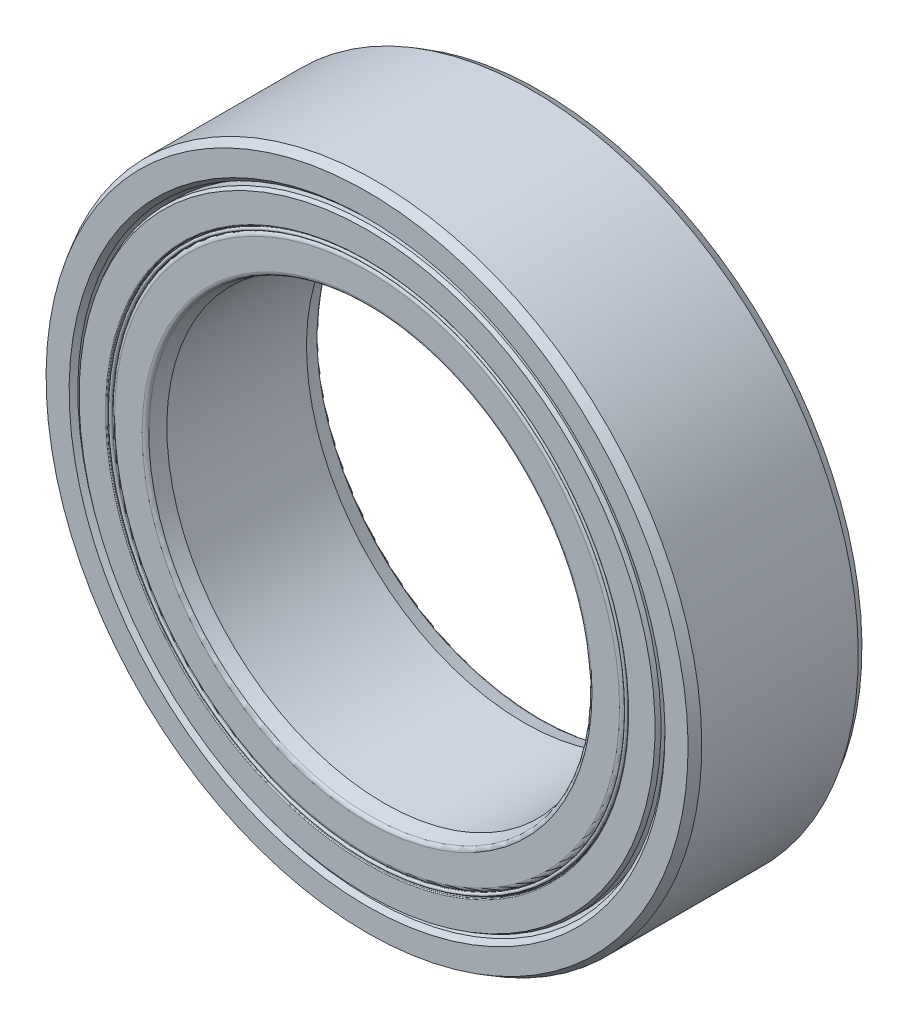
from build123d import *

# Parameters (mm, degrees)
CIRPATTERN1_COUNT = 14


with BuildPart() as part:
    # Sketch3 → Revolve1 (revolve)
    with BuildSketch(Plane(origin=(0, 0, 0), x_dir=(0, 0, -1), z_dir=(1, 0, 0))):
        with BuildLine():
            Line((-1.682987285, 6.675), (-1.9, 6.753986169))
            Line((-1.9, 6.753986169), (-2, 6.853986169))
            Line((-2, 6.853986169), (-2, 7.384529946))
            Line((-2, 7.384529946), (-1.8, 7.5))
            Line((-1.8, 7.5), (1.8, 7.5))
            Line((1.8, 7.5), (2, 7.384529946))
            Line((2, 7.384529946), (2, 6.853986169))
            Line((2, 6.853986169), (1.9, 6.753986169))
            Line((1.9, 6.753986169), (1.682987285, 6.675))
            Line((1.682987285, 6.675), (0.853668554, 6.675))
            ThreePointArc((0.853668554, 6.675), (0, 7.225), (-0.853668554, 6.675))
            Line((-0.853668554, 6.675), (-1.682987285, 6.675))
        make_face()
    revolve(axis=Axis((0, 0, 2), (0, 0, -1)))


with BuildPart() as body_2:
    # Sketch4 → Revolve2 (revolve)
    with BuildSketch(Plane(origin=(0, 0, 0), x_dir=(0, 0, -1), z_dir=(1, 0, 0))):
        with BuildLine():
            Line((-1.606304443, 5), (-1.932858889, 5.0875))
            ThreePointArc((-1.932858889, 5.0875), (-1.981280568, 5.119854332), (-2, 5.175))
            Line((-2, 5.175), (-2, 5.809413334))
            ThreePointArc((-2, 5.809413334), (-1.97346778, 5.87346778), (-1.909413334, 5.9))
            Line((-1.909413334, 5.9), (-0.853668554, 5.9))
            ThreePointArc((-0.853668554, 5.9), (0, 5.35), (0.853668554, 5.9))
            Line((0.853668554, 5.9), (1.909413334, 5.9))
            ThreePointArc((1.909413334, 5.9), (1.97346778, 5.87346778), (2, 5.809413334))
            Line((2, 5.809413334), (2, 5.175))
            ThreePointArc((2, 5.175), (1.981280568, 5.119854332), (1.932858889, 5.0875))
            Line((1.932858889, 5.0875), (1.606304443, 5))
            Line((1.606304443, 5), (-1.606304443, 5))
        make_face()
    revolve(axis=Axis((0, 0, 2), (0, 0, -1)))


with BuildPart() as body_3:
    # Sketch5 → Revolve3 (revolve)
    with BuildSketch(Plane(origin=(0, 0, 0), x_dir=(0, 0, -1), z_dir=(1, 0, 0))):
        with BuildLine():
            Line((-0.9375, 6.2875), (0.9375, 6.2875))
            ThreePointArc((0.9375, 6.2875), (0, 7.225), (-0.9375, 6.2875))
        make_face()
    revolve(axis=Axis((0, 6.2875, 0.9375), (0, 0, -1)))


with BuildPart() as cirpattern1_1:
    # CirPattern1: pattern copy
    add(body_3.part.rotate(Axis((0, 0, 2), (0, 0, -1)), 1 * 360 / CIRPATTERN1_COUNT))


with BuildPart() as cirpattern1_2:
    # CirPattern1: pattern copy
    add(body_3.part.rotate(Axis((0, 0, 2), (0, 0, -1)), 2 * 360 / CIRPATTERN1_COUNT))


with BuildPart() as cirpattern1_3:
    # CirPattern1: pattern copy
    add(body_3.part.rotate(Axis((0, 0, 2), (0, 0, -1)), 3 * 360 / CIRPATTERN1_COUNT))


with BuildPart() as cirpattern1_4:
    # CirPattern1: pattern copy
    add(body_3.part.rotate(Axis((0, 0, 2), (0, 0, -1)), 4 * 360 / CIRPATTERN1_COUNT))


with BuildPart() as cirpattern1_5:
    # CirPattern1: pattern copy
    add(body_3.part.rotate(Axis((0, 0, 2), (0, 0, -1)), 5 * 360 / CIRPATTERN1_COUNT))


with BuildPart() as cirpattern1_6:
    # CirPattern1: pattern copy
    add(body_3.part.rotate(Axis((0, 0, 2), (0, 0, -1)), 6 * 360 / CIRPATTERN1_COUNT))


with BuildPart() as cirpattern1_7:
    # CirPattern1: pattern copy
    add(body_3.part.rotate(Axis((0, 0, 2), (0, 0, -1)), 7 * 360 / CIRPATTERN1_COUNT))


with BuildPart() as cirpattern1_8:
    # CirPattern1: pattern copy
    add(body_3.part.rotate(Axis((0, 0, 2), (0, 0, -1)), 8 * 360 / CIRPATTERN1_COUNT))


with BuildPart() as cirpattern1_9:
    # CirPattern1: pattern copy
    add(body_3.part.rotate(Axis((0, 0, 2), (0, 0, -1)), 9 * 360 / CIRPATTERN1_COUNT))


with BuildPart() as cirpattern1_10:
    # CirPattern1: pattern copy
    add(body_3.part.rotate(Axis((0, 0, 2), (0, 0, -1)), 10 * 360 / CIRPATTERN1_COUNT))


with BuildPart() as cirpattern1_11:
    # CirPattern1: pattern copy
    add(body_3.part.rotate(Axis((0, 0, 2), (0, 0, -1)), 11 * 360 / CIRPATTERN1_COUNT))


with BuildPart() as cirpattern1_12:
    # CirPattern1: pattern copy
    add(body_3.part.rotate(Axis((0, 0, 2), (0, 0, -1)), 12 * 360 / CIRPATTERN1_COUNT))


with BuildPart() as cirpattern1_13:
    # CirPattern1: pattern copy
    add(body_3.part.rotate(Axis((0, 0, 2), (0, 0, -1)), 13 * 360 / CIRPATTERN1_COUNT))


with BuildPart() as body_17:
    # Sketch6 → Revolve4 (revolve)
    with BuildSketch(Plane(origin=(0, 0, 0), x_dir=(0, 0, -1), z_dir=(1, 0, 0))):
        with BuildLine():
            Line((-1.91339746, 6.675), (-0.9375, 6.675))
            Line((-0.9375, 6.675), (-0.9375, 6))
            Line((-0.9375, 6), (-1.98, 6))
            ThreePointArc((-1.98, 6), (-1.994142136, 6.005857864), (-2, 6.02))
            Line((-2, 6.02), (-2, 6.625))
            Line((-2, 6.625), (-1.91339746, 6.675))
        make_face()
        with BuildLine():
            Line((1.98, 6), (0.9375, 6))
            Line((0.9375, 6), (0.9375, 6.675))
            Line((0.9375, 6.675), (1.91339746, 6.675))
            Line((1.91339746, 6.675), (2, 6.625))
            Line((2, 6.625), (2, 6.02))
            ThreePointArc((2, 6.02), (1.994142136, 6.005857864), (1.98, 6))
        make_face()
    revolve(axis=Axis((0, 0, 2), (0, 0, -1)))


with BuildPart() as body_18:
    # Sketch7 → Revolve5 (revolve)
    with BuildSketch(Plane(origin=(0, 0, 0), x_dir=(0, 0, -1), z_dir=(1, 0, 0))):
        with BuildLine():
            Line((-0.9375, 6), (-1.914687217, 6))
            Line((-1.914687217, 6), (-1.93930741, 5.995658796))
            ThreePointArc((-1.93930741, 5.995658796), (-1.947868854, 5.984501305), (-1.9375, 5.975))
            Line((-1.9375, 5.975), (-1.9625, 5.975))
            ThreePointArc((-1.9625, 5.975), (-2, 5.9375), (-1.9625, 5.9))
            Line((-1.9625, 5.9), (-0.9375, 5.9))
            Line((-0.9375, 5.9), (-0.9375, 6))
        make_face()
    revolve(axis=Axis((0, 0, 2), (0, 0, -1)))


solid = Compound([part.part, body_2.part, body_3.part, cirpattern1_1.part, cirpattern1_2.part, cirpattern1_3.part, cirpattern1_4.part, cirpattern1_5.part, cirpattern1_6.part, cirpattern1_7.part, cirpattern1_8.part, cirpattern1_9.part, cirpattern1_10.part, cirpattern1_11.part, cirpattern1_12.part, cirpattern1_13.part, body_17.part, body_18.part])
